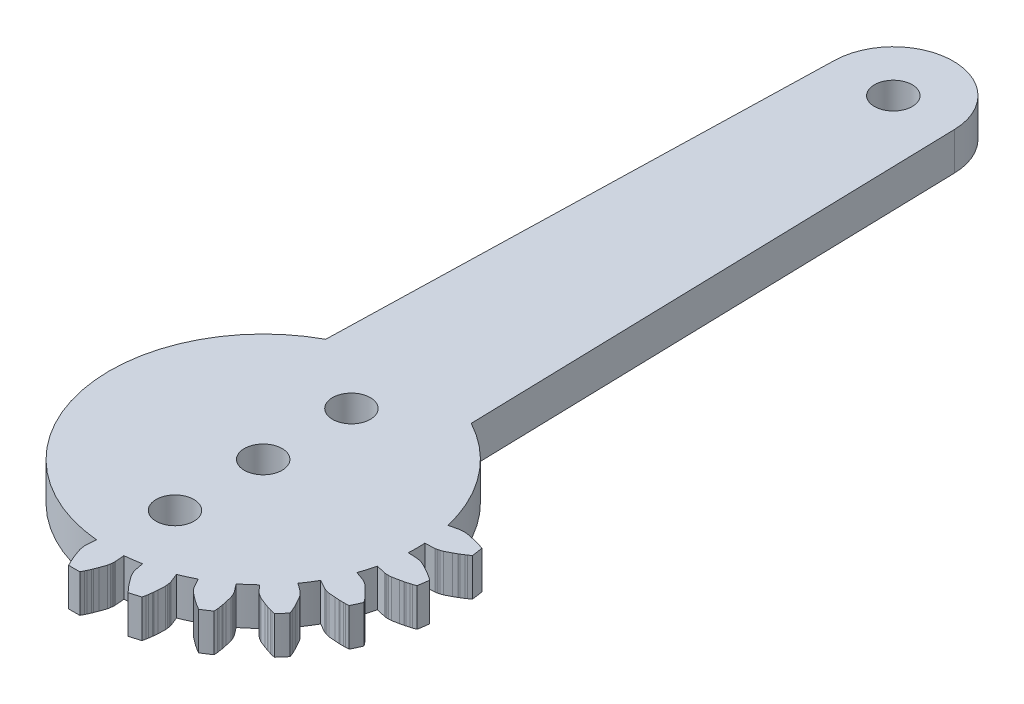
from build123d import *

# Parameters (mm, degrees)
EXTRUDE_1_DEPTH          = 3
SKETCH_2_R               = 12.1875
SKETCH_2_R_2             = 1.5
EXTRUDE_2_DEPTH          = 3
PATTERN_CIRCULAR_2_COUNT = 22
SKETCH_5_R               = 1.5
EXTRUDE_3_DEPTH          = 3
CUT_EXTRUDE_1_DEPTH      = 3


with BuildPart() as part:
    # 草图1 → 凸台-拉伸1 (new body)
    with BuildSketch(Plane(origin=(0, 0, 0), x_dir=(1, 0, 0), z_dir=(0, 1, 0))):
        with BuildLine():
            Line((39.751048724, 40.522419067), (39.686554084, 41.267856945))
            Line((39.686554084, 41.267856945), (39.685130687, 41.328679419))
            Line((39.685130687, 41.328679419), (39.685864546, 41.357680475))
            Line((39.685864546, 41.357680475), (39.691646479, 41.452849434))
            Line((39.691646479, 41.452849434), (39.692944909, 41.469767126))
            Line((39.692944909, 41.469767126), (39.696597708, 41.504162575))
            Line((39.696597708, 41.504162575), (39.712000694, 41.625842063))
            Line((39.712000694, 41.625842063), (39.748222719, 41.824728347))
            ThreePointArc((39.748222719, 41.824728347), (39.836788564, 42.08141601), (39.929464983, 42.336648348))
            Line((39.929464983, 42.336648348), (40.043958498, 42.644244873))
            Line((40.043958498, 42.644244873), (40.045380324, 42.647784709))
            Line((40.045380324, 42.647784709), (40.085544561, 42.739845233))
            Line((40.085544561, 42.739845233), (40.199519113, 42.997146045))
            ThreePointArc((40.199519113, 42.997146045), (40.23147084, 43.066367201), (40.265346714, 43.134667321))
            ThreePointArc((40.265346714, 43.134667321), (40.328973011, 43.256230012), (40.394481299, 43.376788951))
            ThreePointArc((40.394481299, 43.376788951), (40.835680824, 43.383278913), (41.276880349, 43.376788932))
            ThreePointArc((41.276880349, 43.376788932), (41.342388638, 43.256229993), (41.406014935, 43.134667302))
            ThreePointArc((41.406014935, 43.134667302), (41.439890808, 43.066367181), (41.471842535, 42.997146026))
            Line((41.471842535, 42.997146026), (41.585817087, 42.739845214))
            Line((41.585817087, 42.739845214), (41.625981324, 42.647784689))
            Line((41.625981324, 42.647784689), (41.62740315, 42.644244854))
            Line((41.62740315, 42.644244854), (41.741896665, 42.336648329))
            ThreePointArc((41.741896665, 42.336648329), (41.834572754, 42.081415998), (41.923138271, 41.824728347))
            Line((41.923138271, 41.824728347), (41.959360296, 41.625842063))
            Line((41.959360296, 41.625842063), (41.974763282, 41.504162575))
            Line((41.974763282, 41.504162575), (41.978416081, 41.469767126))
            Line((41.978416081, 41.469767126), (41.979714511, 41.452849434))
            Line((41.979714511, 41.452849434), (41.985496444, 41.357680475))
            Line((41.985496444, 41.357680475), (41.986230303, 41.328679419))
            Line((41.986230303, 41.328679419), (41.984806906, 41.267856945))
            Line((41.984806906, 41.267856945), (41.920312266, 40.522419067))
            ThreePointArc((41.920312266, 40.522419067), (40.835680495, 40.570778645), (39.751048724, 40.522419067))
        make_face()
    extrude_1 = extrude(amount=EXTRUDE_1_DEPTH)

    # 草图2 → 凸台-拉伸2 (add)
    with BuildSketch(Plane.XZ):
        with Locations((40.835680495, -28.383278645)):
            Circle(SKETCH_2_R)
        with Locations((40.835680495, -28.383278645)):
            Circle(SKETCH_2_R_2, mode=Mode.SUBTRACT)
        with Locations((40.835680495, -21.383278645)):
            Circle(SKETCH_2_R_2, mode=Mode.SUBTRACT)
        with Locations((40.835680495, -35.383278645)):
            Circle(SKETCH_2_R_2, mode=Mode.SUBTRACT)
    extrude(amount=-EXTRUDE_2_DEPTH)

    # 阵列(圆周)2: 凸台-拉伸1 ×22 about axis
    pattern_circular_2_axis = Axis((40.835680495, 3, -28.383278645), (0, -1, 0))
    for i in range(1, PATTERN_CIRCULAR_2_COUNT):
        add(extrude_1.rotate(pattern_circular_2_axis, i * 360 / PATTERN_CIRCULAR_2_COUNT))

    # 草图5 → 凸台-拉伸3 (add)
    with BuildSketch(Plane.XZ):
        with BuildLine():
            Line((45.585680495, -78.506878604), (46.610680495, -39.115684305))
            ThreePointArc((46.610680495, -39.115684305), (40.835680495, -40.570778645), (35.060680495, -39.115684305))
            Line((35.060680495, -39.115684305), (36.085680495, -78.506878604))
            ThreePointArc((36.085680495, -78.506878604), (40.835680495, -83.134886473), (45.585680495, -78.506878604))
        make_face()
        with Locations((40.835680495, -78.383278645)):
            Circle(SKETCH_5_R, mode=Mode.SUBTRACT)
    extrude(amount=-EXTRUDE_3_DEPTH)

    # 草图7 → 切除-拉伸1 (cut)
    with BuildSketch(Plane.XZ):
        with BuildLine():
            Line((35.060680495, -39.115684305), (35.068180495, -39.403912537))
            Line((35.068180495, -39.403912537), (34.836458203, -39.843740301))
            Line((34.836458203, -39.843740301), (33.621076182, -45.069775655))
            Line((33.621076182, -45.069775655), (23.29469854, -35.421541283))
            Line((23.29469854, -35.421541283), (25.189109524, -22.168156693))
            Line((25.189109524, -22.168156693), (31.430752441, -11.204000881))
            Line((31.430752441, -11.204000881), (37.969616449, -9.816969122))
            Line((37.969616449, -9.816969122), (39.751048724, -16.244138224))
            ThreePointArc((39.751048724, -16.244138224), (28.89664611, -25.93488852), (35.060680495, -39.115684305))
        make_face()
        with BuildLine():
            Line((46.610680495, -39.115684305), (46.603180496, -39.403912537))
            Line((46.603180496, -39.403912537), (47.014217925, -42.363226189))
            Line((47.014217925, -42.363226189), (53.527706743, -41.712847694))
            Line((53.527706743, -41.712847694), (55.437535773, -32.439444059))
            Line((55.437535773, -32.439444059), (52.32840334, -32.439444059))
            ThreePointArc((52.32840334, -32.439444059), (50.09238666, -36.31098621), (46.610680495, -39.115684305))
        make_face()
    extrude(amount=-CUT_EXTRUDE_1_DEPTH, mode=Mode.SUBTRACT)


solid = part.part
